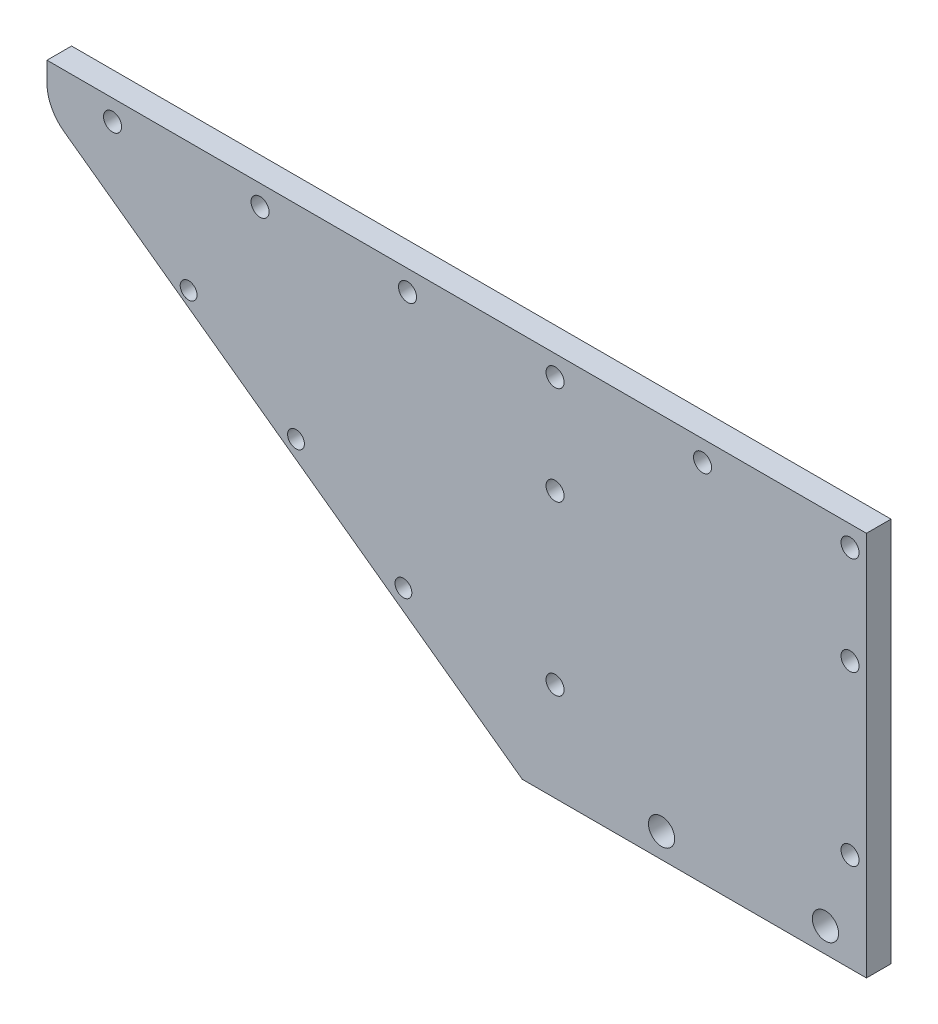
from build123d import *

# Parameters (mm, degrees)
EXTRUDE_1_DEPTH     = 3
SKETCH_2_R          = 1.1
SKETCH_2_R_2        = 1.025013192
SKETCH_2_R_3        = 1.6
CUT_EXTRUDE_2_DEPTH = 111.535062311
FILLET_1_R          = 5


with BuildPart() as part:
    # 草图1 → 凸台-拉伸1 (new body)
    with BuildSketch(Plane.XY):
        Polygon((0, 0), (0, -47), (-42, -47), (-100, -5), (-100, 0), align=None)
    extrude(amount=EXTRUDE_1_DEPTH)

    # 草图2 → 切除-拉伸2 (cut, through all)
    with BuildSketch(Plane.XY.offset(3)):
        with Locations((-38, -35)):
            Circle(SKETCH_2_R)
        with Locations((-38, -14.5)):
            Circle(SKETCH_2_R)
        with Locations((-38, -2.5)):
            Circle(SKETCH_2_R)
        with Locations((-56, -2.5)):
            Circle(SKETCH_2_R)
        with Locations((-74, -2.5)):
            Circle(SKETCH_2_R)
        with Locations((-92, -2.5)):
            Circle(SKETCH_2_R)
        with Locations((-56.501870582, -34.029333193)):
            Circle(SKETCH_2_R_2)
        with Locations((-69.609581311, -24.853935684)):
            Circle(SKETCH_2_R_2)
        with Locations((-82.717292039, -15.678538174)):
            Circle(SKETCH_2_R_2)
        with Locations((-20, -2.5)):
            Circle(SKETCH_2_R)
        with Locations((-2, -2.5)):
            Circle(SKETCH_2_R)
        with Locations((-2, -14.5)):
            Circle(SKETCH_2_R)
        with Locations((-2, -35)):
            Circle(SKETCH_2_R)
        with Locations((-5, -44)):
            Circle(SKETCH_2_R_3)
        with Locations((-25, -44)):
            Circle(SKETCH_2_R_3)
    extrude(amount=-CUT_EXTRUDE_2_DEPTH, mode=Mode.SUBTRACT)

    # 圆角1
    fillet_1_edges = [part.edges().sort_by_distance(p)[0] for p in [
        (-100, -5, 1.5),
    ]]
    fillet(fillet_1_edges, radius=FILLET_1_R)


solid = part.part
